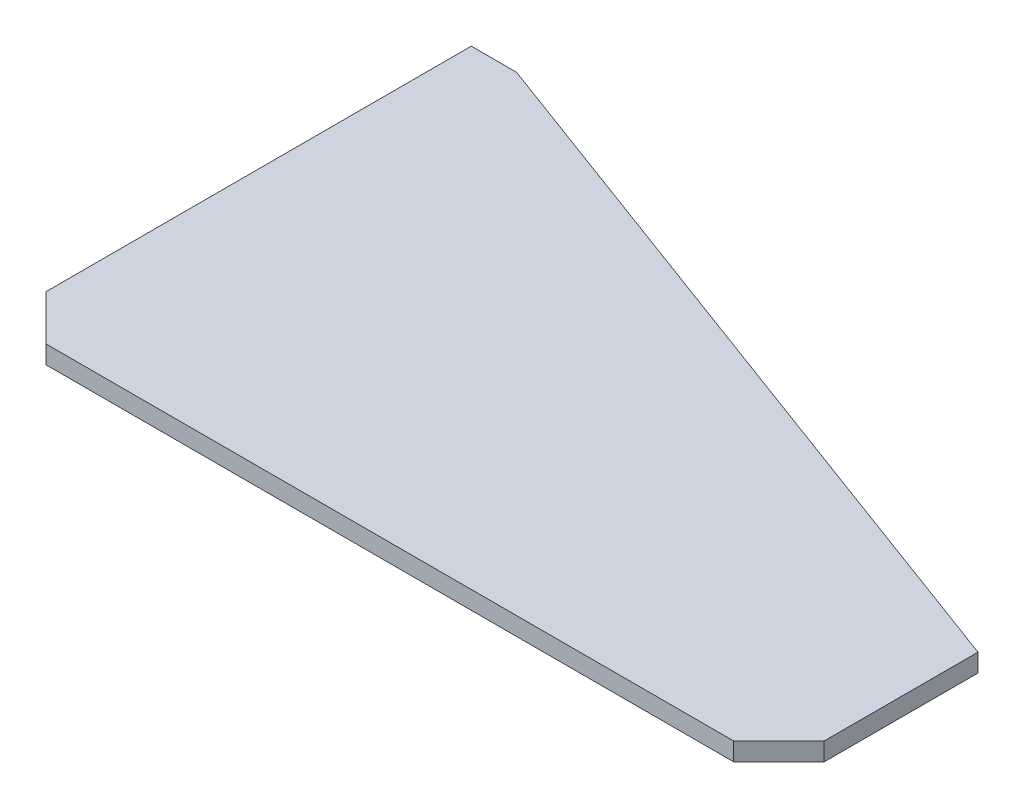
from build123d import *

# Parameters (mm, degrees)
EXTRUDE_1_DEPTH = 2
CHAMFER_2_SIZE  = 5


with BuildPart() as part:
    # Эскиз1 → Бобышка-Вытянуть1 (new body)
    with BuildSketch(Plane(origin=(0, 0, 0), x_dir=(1, 0, 0), z_dir=(0, 1, 0))):
        Polygon((5, 52), (86, 22), (86, 0), (0, 0), (0, 52), align=None)
    extrude(amount=EXTRUDE_1_DEPTH)

    # Фаска2
    chamfer_2_edges = [part.edges().sort_by_distance(p)[0] for p in [
        (0, 1, 0),
        (86, 1, 0),
    ]]
    chamfer(chamfer_2_edges, length=CHAMFER_2_SIZE)


solid = part.part
